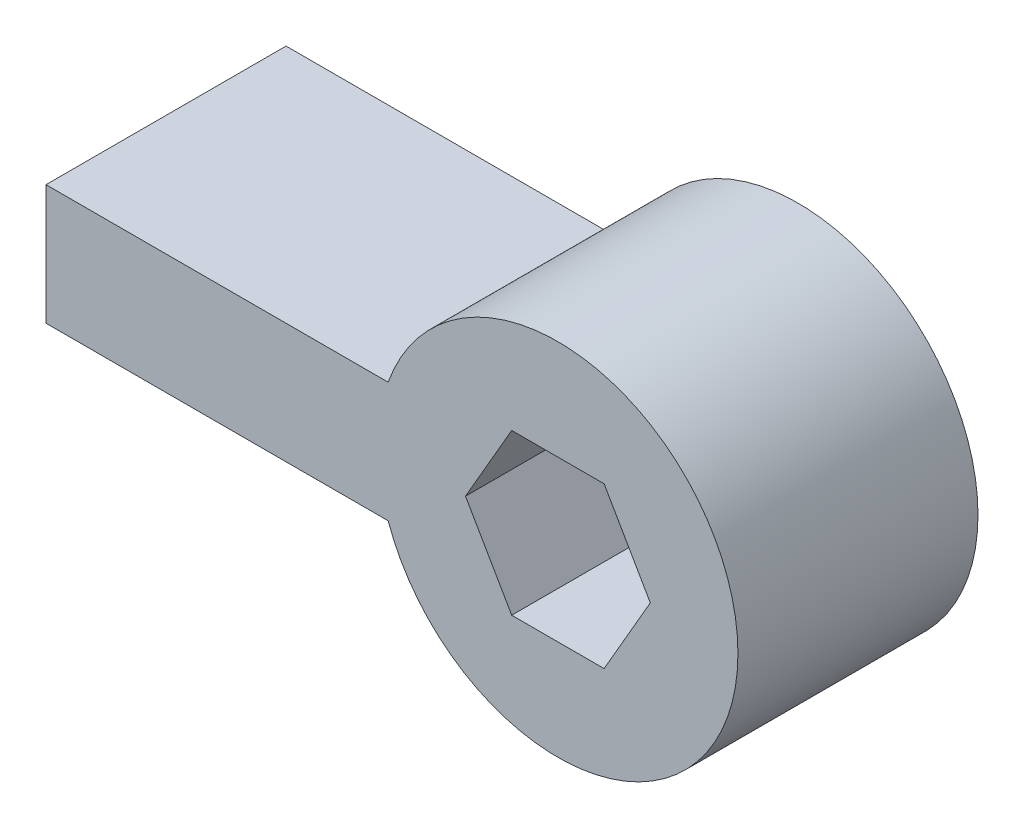
from build123d import *

# Parameters (mm, degrees)
SKETCH1_R                = 4.5
BOSS_EXTRUDE1_DEPTH      = 6
BOSS_EXTRUDE2_DEPTH      = 1.5
BOSS_EXTRUDE2_DEPTH_BACK = 1.5


with BuildPart() as part:
    # Sketch1 → Boss-Extrude1 (new body)
    with BuildSketch(Plane.XY):
        with Locations((5.549376682, 2)):
            Circle(SKETCH1_R)
        Polygon((4.394676144, 0), (6.704077221, 0), (7.858777759, 2), (6.704077221, 4), (4.394676144, 4), (3.239975606, 2), align=None, mode=Mode.SUBTRACT)
    extrude(amount=BOSS_EXTRUDE1_DEPTH)

    # Sketch2 → Boss-Extrude2 (add, two sides: drawn at the far end of the back side and taken through both)
    with BuildSketch(Plane(origin=(0, 2, 0), x_dir=(1, 0, 0), z_dir=(0, 1, 0)).offset(-BOSS_EXTRUDE2_DEPTH_BACK)):
        Polygon((3.239975606, 0), (1.049376682, 0), (-7.245305078, 0), (-7.245305078, -6), (1.049376682, -6), (3.239975606, -6), align=None)
    extrude(amount=BOSS_EXTRUDE2_DEPTH + BOSS_EXTRUDE2_DEPTH_BACK)


solid = part.part
